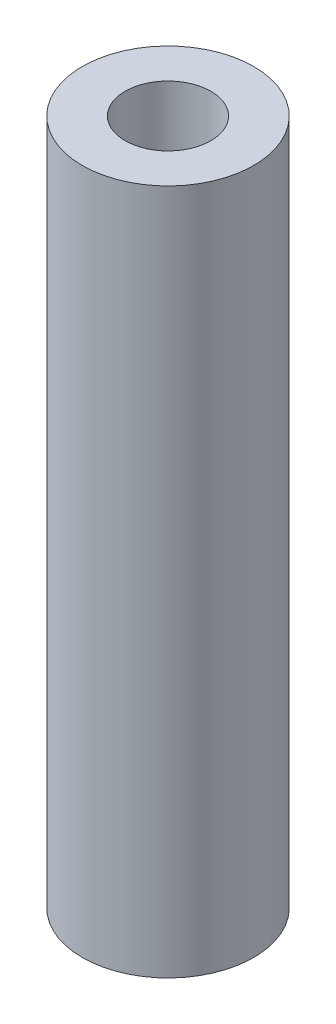
from build123d import *

# Parameters (mm, degrees)
SKETCH1_R           = 38.1
SKETCH1_R_2         = 19.05
BOSS_EXTRUDE1_DEPTH = 304.8


with BuildPart() as part:
    # Sketch1 → Boss-Extrude1 (new body)
    with BuildSketch(Plane(origin=(0, 0, 0), x_dir=(1, 0, 0), z_dir=(0, 1, 0))):
        Circle(SKETCH1_R)
        Circle(SKETCH1_R_2, mode=Mode.SUBTRACT)
    extrude(amount=BOSS_EXTRUDE1_DEPTH)


solid = part.part
